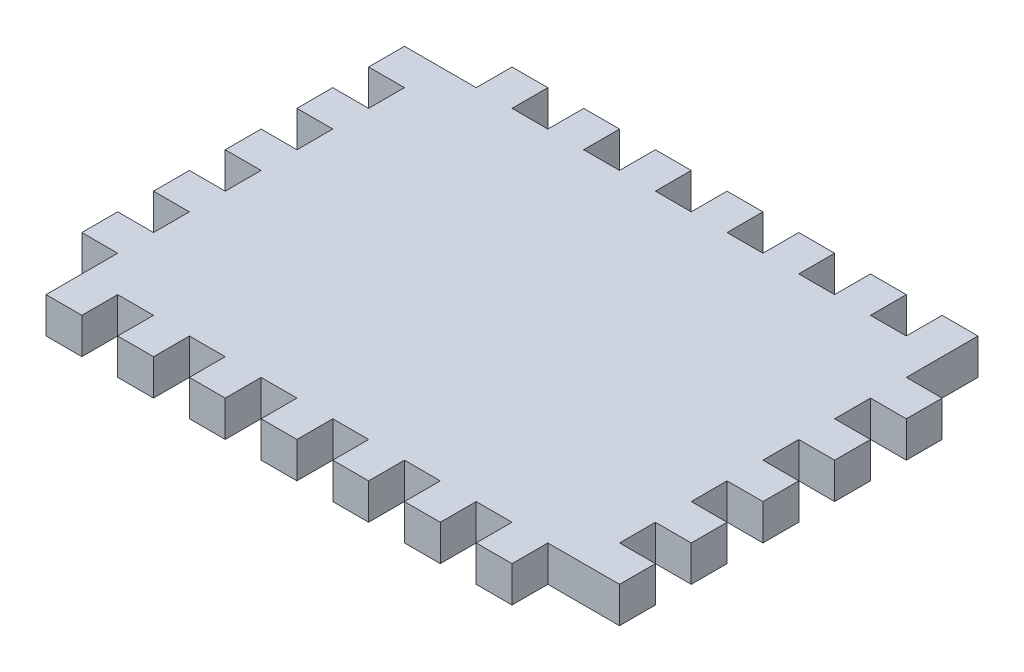
from build123d import *

# Parameters (mm, degrees)
SKETCH1_W           = 203.2
SKETCH1_H           = 152.4
BOSS_EXTRUDE1_DEPTH = 12.7
SKETCH2_W           = 25.4
SKETCH2_H           = 12.7
SKETCH2_W_2         = 12.7
SKETCH2_H_2         = 25.4
CUT_EXTRUDE1_DEPTH  = 128.633420388
CIRPATTERN1_COUNT   = 2


with BuildPart() as part:
    # Sketch1 → Boss-Extrude1 (new body)
    with BuildSketch(Plane(origin=(0, 0, 0), x_dir=(1, 0, 0), z_dir=(0, 1, 0))):
        Rectangle(SKETCH1_W, SKETCH1_H)
    extrude(amount=BOSS_EXTRUDE1_DEPTH)

    # Sketch2 → Cut-Extrude1 (cut, through all)
    with BuildSketch(Plane(origin=(0, 12.7, 0), x_dir=(1, 0, 0), z_dir=(0, 1, 0))):
        with Locations((-88.9, 69.85)):
            Rectangle(SKETCH2_W, SKETCH2_H)
        with Locations((-57.15, 69.85)):
            Rectangle(SKETCH2_W_2, SKETCH2_H)
        with Locations((-31.75, 69.85)):
            Rectangle(SKETCH2_W_2, SKETCH2_H)
        with Locations((-6.35, 69.85)):
            Rectangle(SKETCH2_W_2, SKETCH2_H)
        with Locations((19.05, 69.85)):
            Rectangle(SKETCH2_W_2, SKETCH2_H)
        with Locations((44.45, 69.85)):
            Rectangle(SKETCH2_W_2, SKETCH2_H)
        with Locations((69.85, 69.85)):
            Rectangle(SKETCH2_W_2, SKETCH2_H)
        with Locations((95.25, 63.5)):
            Rectangle(SKETCH2_W_2, SKETCH2_H_2)
        with Locations((95.25, 31.75)):
            Rectangle(SKETCH2_W_2, SKETCH2_H)
        with Locations((95.25, 6.35)):
            Rectangle(SKETCH2_W_2, SKETCH2_H)
        with Locations((95.25, -19.05)):
            Rectangle(SKETCH2_W_2, SKETCH2_H)
        with Locations((95.25, -44.45)):
            Rectangle(SKETCH2_W_2, SKETCH2_H)
        with Locations((95.25, -69.85)):
            Rectangle(SKETCH2_W_2, SKETCH2_H)
    cut_extrude1 = extrude(amount=-CUT_EXTRUDE1_DEPTH, mode=Mode.SUBTRACT)

    # CirPattern1: Cut-Extrude1 ×2 about axis
    cirpattern1_axis = Axis((0, 0, 0), (0, 1, 0))
    for i in range(1, CIRPATTERN1_COUNT):
        add(cut_extrude1.rotate(cirpattern1_axis, i * 360 / CIRPATTERN1_COUNT), mode=Mode.SUBTRACT)


solid = part.part
